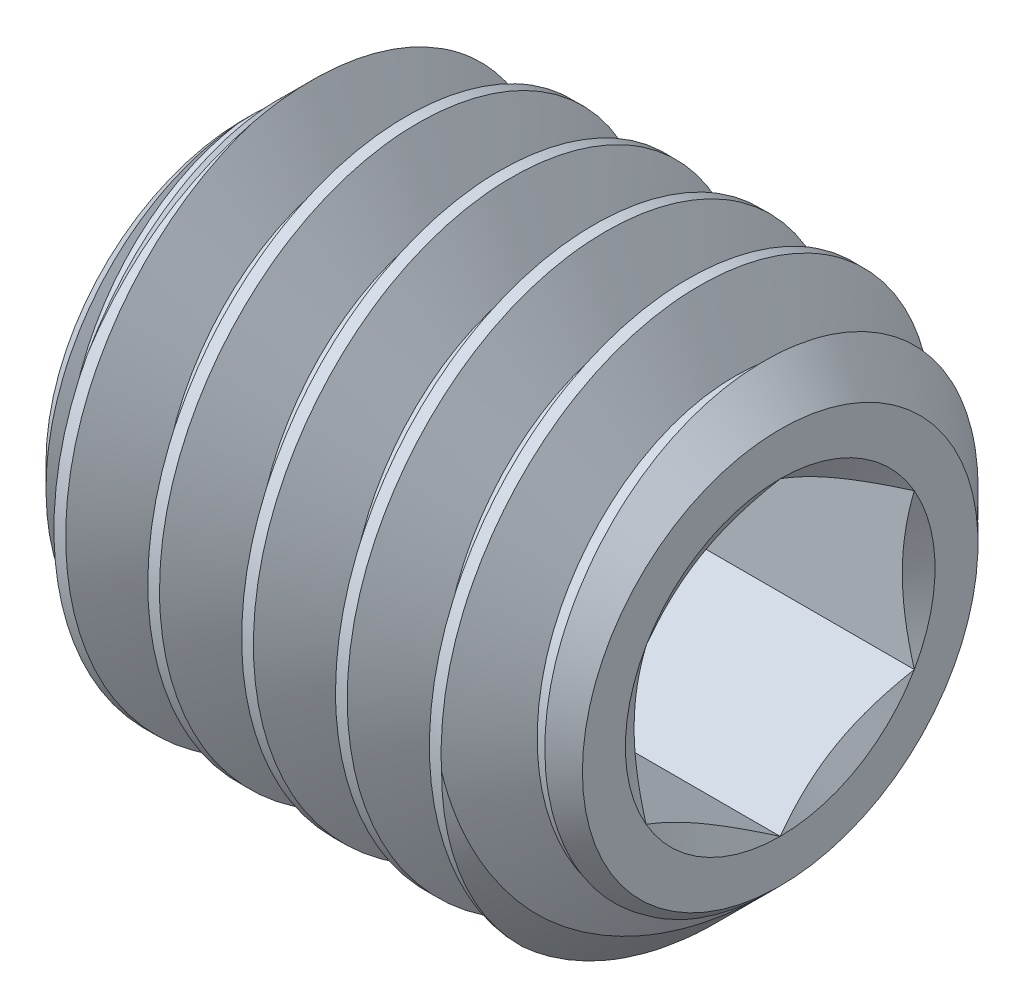
from build123d import *

# Parameters (mm, degrees)
CUT_EXTRUDE1_DEPTH = 2
CUT_SWEEP4_PITCH   = 0.7


with BuildPart() as part:
    # Sketch2 → Revolve1 (revolve)
    with BuildSketch(Plane.XY, mode=Mode.PRIVATE) as revolve1_sk:
        Polygon((-2, 0), (-2, 1.475), (-1.475, 2), (1.475, 2), (2, 1.475), (2, 0), align=None)
    revolve(revolve1_sk.sketch.rotate(Axis((-2, 0, 0), (1, 0, 0)), 90), axis=Axis((-2, 0, 0), (1, 0, 0)))

    # Sketch3 → Cut-Extrude1 (cut)
    with BuildSketch(Plane(origin=(2, 0, 0), x_dir=(0, 0, -1), z_dir=(1, 0, 0))):
        Polygon((-1, -0.577350269), (0, -1.154700538), (1, -0.577350269), (1, 0.577350269), (0, 1.154700538), (-1, 0.577350269), align=None)
    extrude(amount=-CUT_EXTRUDE1_DEPTH, mode=Mode.SUBTRACT)

    # Cut-Extrude2 cone 1 section (through the dimple's axis) → Cut-Extrude2 (revolve, cut)
    with BuildSketch(Plane(origin=(2, 0, 0), x_dir=(0, 0, -1), z_dir=(0, 1, 0))):
        Polygon((0, 0), (1.154700538, 0), (0, 0.666666667), align=None)
    revolve(axis=Axis((2, 0, 0), (-1, 0, 0)), mode=Mode.SUBTRACT)

    # Cut-Sweep4: the profile of Sketch7 screwed along a right-hand helix of 7.714286 turns, 6 arcs to a turn; built about Z, then put on its axis
    cut_sweep4_z = Axis((0, 0, 0), (0, 0, 1))
    cut_sweep4_corners = [(2.037888611, 0, -3.978125), (1.545336663, 0, -4.2625), (1.545336663, 0, -4.35), (2.037888611, 0, -4.634375)]
    with BuildLine(mode=Mode.PRIVATE) as cut_sweep4_profile:
        Line(cut_sweep4_corners[0], cut_sweep4_corners[1])
        Line(cut_sweep4_corners[1], cut_sweep4_corners[2])
        Line(cut_sweep4_corners[2], cut_sweep4_corners[3])
        Line(cut_sweep4_corners[3], cut_sweep4_corners[0])
    cut_sweep4_cap = Face(cut_sweep4_profile.wire())
    cut_sweep4_turn_angles = [0, 30, 60, 90, 120, 150, 180, 210, 240, 270, 300, 330, 360]
    cut_sweep4_turn_weights = [1, 0.8660254037844387, 1, 0.8660254037844387, 1, 0.8660254037844387, 1, 0.8660254037844387, 1, 0.8660254037844387, 1, 0.8660254037844387, 1]
    cut_sweep4_turn_rails = [Edge.make_bspline([Vector(p[0], p[1], 0).rotate(cut_sweep4_z, cut_sweep4_turn_angles[k]) / cut_sweep4_turn_weights[k] + Vector(0, 0, p[2] + CUT_SWEEP4_PITCH * cut_sweep4_turn_angles[k] / 360) for k in range(13)], [0, 0, 0, 1, 1, 2, 2, 3, 3, 4, 4, 5, 5, 6, 6, 6], 2, cut_sweep4_turn_weights) for p in cut_sweep4_corners]
    cut_sweep4_turn_sides = [Face.make_surface_from_curves(cut_sweep4_turn_rails[p[0]], cut_sweep4_turn_rails[p[1]]) for p in [(0, 1), (1, 2), (2, 3), (3, 0)]]
    cut_sweep4_last_angles = [2520, 2550, 2580, 2610, 2640, 2670, 2700, 2730, 2760, 2768.571428571, 2777.142857143]
    cut_sweep4_last_weights = [1, 0.8660254037844387, 1, 0.8660254037844387, 1, 0.8660254037844387, 1, 0.8660254037844387, 1, 0.9888308262251319, 1]
    cut_sweep4_last_rails = [Edge.make_bspline([Vector(p[0], p[1], 0).rotate(cut_sweep4_z, cut_sweep4_last_angles[k]) / cut_sweep4_last_weights[k] + Vector(0, 0, p[2] + CUT_SWEEP4_PITCH * cut_sweep4_last_angles[k] / 360) for k in range(11)], [0, 0, 0, 1, 1, 2, 2, 3, 3, 4, 4, 5, 5, 5], 2, cut_sweep4_last_weights) for p in cut_sweep4_corners]
    cut_sweep4_last_sides = [Face.make_surface_from_curves(cut_sweep4_last_rails[p[0]], cut_sweep4_last_rails[p[1]]) for p in [(0, 1), (1, 2), (2, 3), (3, 0)]]
    cut_sweep4 = Plane(origin=(-2, 0, 0), x_dir=(0, 1, 0), z_dir=(-1, 0, 0)) * Solid(Shell([*[p.moved(Location((0, 0, CUT_SWEEP4_PITCH * i))) for i in range(7) for p in cut_sweep4_turn_sides], *cut_sweep4_last_sides, cut_sweep4_cap, cut_sweep4_cap.rotate(cut_sweep4_z, 2777.142857143).moved(Location((0, 0, CUT_SWEEP4_PITCH * 2777.142857143 / 360)))]))
    add(cut_sweep4, mode=Mode.SUBTRACT)


solid = part.part
